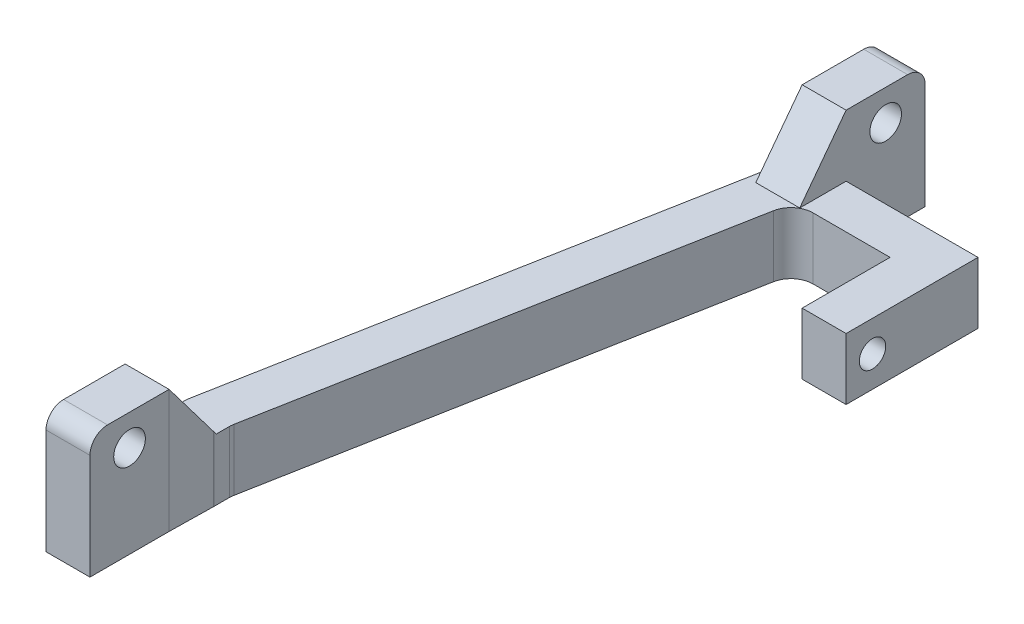
from build123d import *

# Parameters (mm, degrees)
BOSS_EXTRUDE1_DEPTH      = 7
BOSS_EXTRUDE2_START      = 7
SKETCH1_3_W              = 5
SKETCH1_3_H              = 9
BOSS_EXTRUDE2_DEPTH      = 7
M3_CLEARANCE_HOLE1_D     = 3.6
FILLET2_R                = 2.5
BOSS_EXTRUDE3_DEPTH      = 10
BOSS_EXTRUDE3_DEPTH_BACK = 5
SKETCH6_W                = 5
SKETCH6_H                = 7
SKETCH7_R                = 1.5
CUT_EXTRUDE1_DEPTH       = 10
FILLET6_R                = 2
SKETCH8_W                = 84
SKETCH8_H                = 14
CUT_EXTRUDE2_DEPTH       = 83.35289916
CHAMFER2_SIZE            = 7
CHAMFER2_SIZE_2          = 5.274878351


with BuildPart() as part:
    # Sketch1 → Boss-Extrude1 (new body)
    with BuildSketch(Plane(origin=(0, 0, 0), x_dir=(1, 0, 0), z_dir=(0, 1, 0))):
        Polygon((-23.5, -9), (-23.5, 0), (-23.413842004, 5), (-23.413842004, 7), (-13.346045394, 61), (13.346045394, 61), (23.413842004, 7), (23.413842004, 5), (23.5, 0), (23.5, -9), (28.5, -9), (28.5, 7), (17.5, 66), (17.5, 75), (12.5, 75), (12.5, 66), (-12.5, 66), (-12.5, 75), (-17.5, 75), (-17.5, 66), (-28.5, 7), (-28.5, -9), align=None)
    extrude(amount=BOSS_EXTRUDE1_DEPTH)

    # Sketch1<3> → Boss-Extrude2 (add)
    with BuildSketch(Plane(origin=(0, 0, 0), x_dir=(1, 0, 0), z_dir=(0, 1, 0)).offset(BOSS_EXTRUDE2_START)):
        with Locations((-15, 70.5)):
            Rectangle(SKETCH1_3_W, SKETCH1_3_H)
        with Locations((15, 70.5)):
            Rectangle(SKETCH1_3_W, SKETCH1_3_H)
        with Locations((-26, -4.5)):
            Rectangle(SKETCH1_3_W, SKETCH1_3_H)
        with Locations((26, -4.5)):
            Rectangle(SKETCH1_3_W, SKETCH1_3_H)
    extrude(amount=BOSS_EXTRUDE2_DEPTH)

    # M3 Clearance Hole1 (through all)
    with Locations(Plane(origin=(28.5, 0, 0), x_dir=(0, 0, -1), z_dir=(1, 0, 0))):
        with Locations((-4.5, 10.5), (70.5, 10.5)):
            Hole(M3_CLEARANCE_HOLE1_D / 2)

    # Fillet2
    fillet2_edges = [part.edges().sort_by_distance(p)[0] for p in [
        (-28.5, 3.5, -7),
        (-17.5, 3.5, -66),
        (17.5, 3.5, -66),
        (28.5, 3.5, -7),
        (23.413842004, 3.5, -5),
        (23.413842004, 3.5, -7),
        (13.346045394, 3.5, -61),
        (-13.346045394, 3.5, -61),
        (-23.413842004, 3.5, -7),
        (-23.413842004, 3.5, -5),
    ]]
    fillet(fillet2_edges, radius=FILLET2_R)

    # Sketch6 → Boss-Extrude3 (add, two sides: drawn at the far end of the back side and taken through both)
    with BuildSketch(Plane.XY.offset(-61).offset(-BOSS_EXTRUDE3_DEPTH_BACK)):
        with Locations((0, 3.5)):
            Rectangle(SKETCH6_W, SKETCH6_H)
    extrude(amount=BOSS_EXTRUDE3_DEPTH + BOSS_EXTRUDE3_DEPTH_BACK)

    # Sketch7 → Cut-Extrude1 (cut)
    with BuildSketch(Plane.ZY.offset(2.5)):
        with Locations(Location((-54, 3.5, 0), (0, 0, 270))):
            Circle(SKETCH7_R)
    extrude(amount=-CUT_EXTRUDE1_DEPTH, mode=Mode.SUBTRACT)

    # Fillet6
    fillet6_edges = [part.edges().sort_by_distance(p)[0] for p in [
        (26, 14, 9),
        (-15, 14, -75),
        (15, 14, -75),
        (-26, 14, 9),
    ]]
    fillet(fillet6_edges, radius=FILLET6_R)

    # Sketch8 → Cut-Extrude2 (cut, through all)
    with BuildSketch(Plane(origin=(2.5, 0, 0), x_dir=(0, 0, -1), z_dir=(1, 0, 0))):
        with Locations((33, 7)):
            Rectangle(SKETCH8_W, SKETCH8_H)
    extrude(amount=CUT_EXTRUDE2_DEPTH, mode=Mode.SUBTRACT)

    # Chamfer2
    # the kernel refuses this chamfer: 7, 5.274878351 mm, written as the material it adds along each edge
    with BuildSketch(Plane(origin=(-5.436042239, 7, 0), x_dir=(0, 0.9997280272590686, 0.023321052992758308), z_dir=(-1, 0, 0))) as chamfer2_piece_1_section:
        Polygon((CHAMFER2_SIZE * 0.999728027259, CHAMFER2_SIZE * 0.0233210529928), (-CHAMFER2_SIZE_2 * 0.0233210529915, CHAMFER2_SIZE_2 * 0.999728027206), (0, 0), align=None)
    chamfer2_piece_1 = extrude(amount=23.063957761, mode=Mode.PRIVATE)
    chamfer2_piece_1 = split(chamfer2_piece_1, bisect_by=Plane(origin=(-23.413842004, 8.750234769, -2.637085353), z_dir=(-1, 0, 0)), keep=Keep.TOP, mode=Mode.PRIVATE)
    chamfer2_piece_1 = split(chamfer2_piece_1, bisect_by=Plane(origin=(-23.454565548, 8.750234769, -2.636693852), z_dir=(-0.999851569048757, 0, -0.01722904149216463)), keep=Keep.TOP, mode=Mode.PRIVATE)
    add(chamfer2_piece_1)
    with BuildSketch(Plane(origin=(-17.5, 7, -66), x_dir=(2.839775720480132e-15, -0.0410460451010975, 0.9991572559820394), z_dir=(1, 0, 0))) as chamfer2_piece_2:
        Polygon((CHAMFER2_SIZE_2 * 0.999157255929, -CHAMFER2_SIZE_2 * 0.0410460450989), (-CHAMFER2_SIZE * 0.0410460451011, -CHAMFER2_SIZE * 0.999157255982), (0, 0), align=None)
    extrude(amount=5)


solid = part.part
